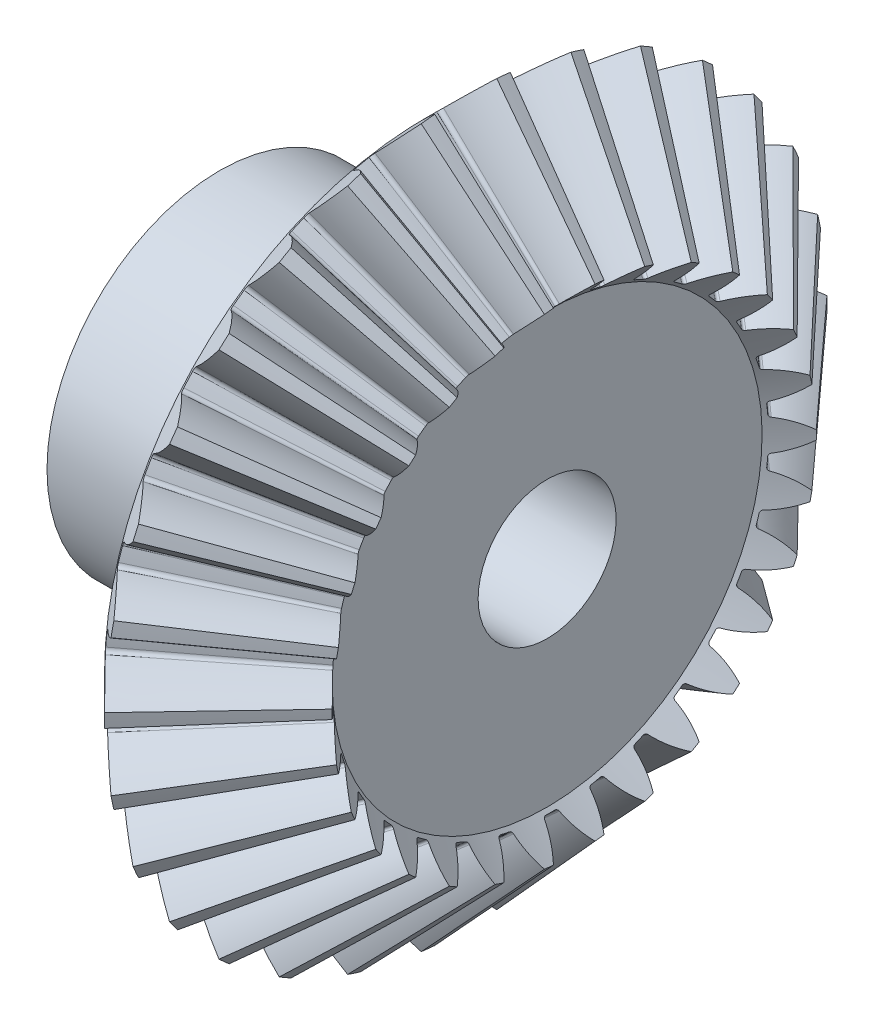
from build123d import *

# Parameters (mm, degrees)
TEETHCUTS_COUNT = 30
TEETHCUTS_ANGLE = 348
HUBSKE_R        = 7.5
HUB_DEPTH       = 8.949164146
BORSKE_R        = 3
BORE_DEPTH      = 25.0000508


with BuildPart() as part:
    # BasProSke → Base-Revolve (revolve)
    with BuildSketch(Plane(origin=(0, 0, 0), x_dir=(1, 0, 0), z_dir=(0, 1, 0)), mode=Mode.PRIVATE) as base_revolve_sk:
        Polygon((0, 0), (0, 13.949062547), (1.758044236, 15.707106781), (6.474458366, 10.524025974), (5.296539131, 9.346106741), (5.296539131, 0), align=None)
    revolve(base_revolve_sk.sketch.rotate(Axis((-10, 0, 0), (1, 0, 0)), 180), axis=Axis((-10, 0, 0), (1, 0, 0)))

    # ToothCut: read off the stored shape, not the designer's step
    # ToothCut: loft between two sections, ruled curve by curve
    toothcut_from = [
        Edge.make_bspline([(16.057310157, 0.006372702, -0.008948016), (16.052955033, 0.002017579, -0.015151394), (16.046805452, -0.004132002, -0.014267426), (16.04342198, -0.007515475, -0.006951667)], [0, 0, 0, 0, 1, 1, 1, 1], 3, [1, 0.752798, 0.752798, 1]),
        Edge.make_bspline([(16.04342198, -0.007515475, 0.006951667), (16.046805452, -0.004132002, 0.014267426), (16.052955033, 0.002017579, 0.015151394), (16.057310157, 0.006372702, 0.008948016)], [0, 0, 0, 0, 1, 1, 1, 1], 3, [1, 0.752798, 0.752798, 1]),
        Edge.make_bspline([(16.04342198, -0.007515475, -0.006951667), (16.042991938, -0.007945517, -0.00602183), (16.042651363, -0.008286091, -0.005020587), (16.042406078, -0.008531377, -0.003965059)], [0, 0, 0, 0, 1, 1, 1, 1], 3, [1, 0.994300589, 0.994300589, 1]),
        Edge.make_bspline([(16.042406078, -0.008531377, 0.003965059), (16.042651363, -0.008286091, 0.005020587), (16.042991938, -0.007945517, 0.00602183), (16.04342198, -0.007515475, 0.006951667)], [0, 0, 0, 0, 1, 1, 1, 1], 3, [1, 0.994300589, 0.994300589, 1]),
        Edge.make_bspline([(16.042406078, -0.008531377, -0.003965059), (16.041802396, -0.009135059, -0.001367249), (16.041802396, -0.009135059, 0.001367249), (16.042406078, -0.008531377, 0.003965059)], [0, 0, 0, 0, 1, 1, 1, 1], 3, [1, 0.966675555, 0.966675555, 1]),
        Edge.make_line((16.057310157, 0.006372702, 0.008948016), (16.057310157, 0.006372702, -0.008948016)),
    ]
    toothcut_to = [
        Edge.make_bspline([(1.93183305, 15.880895594, -1.554738237), (1.450416696, 15.39947924, -1.033713021), (0.902073449, 14.851135995, -0.668158569), (0.311519787, 14.260582334, -0.474552183)], [0, 0, 0, 0, 1, 1, 1, 1], 3, [1, 0.984975059, 0.984975059, 1]),
        Edge.make_bspline([(0.311519787, 14.260582334, 0.474552183), (0.902073449, 14.851135995, 0.668158569), (1.450416696, 15.39947924, 1.033713021), (1.93183305, 15.880895594, 1.554738237)], [0, 0, 0, 0, 1, 1, 1, 1], 3, [1, 0.984975059, 0.984975059, 1]),
        Edge.make_bspline([(0.311519787, 14.260582334, -0.474552183), (0.247234926, 14.196297473, -0.453477114), (0.206716831, 14.155779378, -0.379816993), (0.208085806, 14.157148353, -0.286513739)], [0, 0, 0, 0, 1, 1, 1, 1], 3, [1, 0.850928303, 0.850928303, 1]),
        Edge.make_bspline([(0.208085806, 14.157148353, 0.286513739), (0.206716831, 14.155779378, 0.379816993), (0.247234926, 14.196297473, 0.453477114), (0.311519787, 14.260582334, 0.474552183)], [0, 0, 0, 0, 1, 1, 1, 1], 3, [1, 0.850928303, 0.850928303, 1]),
        Edge.make_bspline([(0.208085806, 14.157148353, -0.286513739), (0.210888153, 14.1599507, -0.095518284), (0.210888153, 14.1599507, 0.095518284), (0.208085806, 14.157148353, 0.286513739)], [0, 0, 0, 0, 1, 1, 1, 1], 3, [1, 0.999856528, 0.999856528, 1]),
        Edge.make_line((1.93183305, 15.880895594, 1.554738237), (1.93183305, 15.880895594, -1.554738237)),
    ]
    toothcut = Solid(Shell([*[Face.make_surface_from_curves(toothcut_from[k], toothcut_to[k]) for k in range(6)], Face(Wire(toothcut_from)), Face(Wire(toothcut_to))]))
    add(toothcut, mode=Mode.SUBTRACT)

    # TeethCuts: ToothCut ×30 about axis
    teethcuts_axis = Axis((-10, 0, 0), (1, 0, 0))
    for i in range(1, TEETHCUTS_COUNT):
        add(toothcut.rotate(teethcuts_axis, i * TEETHCUTS_ANGLE / (TEETHCUTS_COUNT - 1)), mode=Mode.SUBTRACT)

    # HubSke → Hub (add)
    with BuildSketch(Plane.ZY):
        with Locations(Location((0, 0, 0), (0, 0, 180))):
            Circle(HUBSKE_R)
    extrude(amount=HUB_DEPTH)

    # BorSke → Bore (cut, symmetric)
    with BuildSketch(Plane(origin=(0, 0, 0), x_dir=(0, 0, -1), z_dir=(1, 0, 0))):
        with Locations(Location((0, 0, 0), (0, 0, 180))):
            Circle(BORSKE_R)
    extrude(amount=BORE_DEPTH, both=True, mode=Mode.SUBTRACT)


solid = part.part
